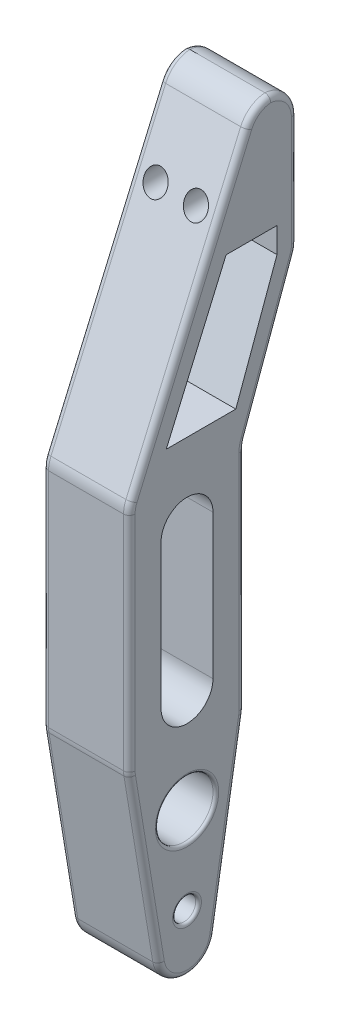
from build123d import *

# Parameters (mm, degrees)
SKETCH2_R           = 4
SKETCH2_R_2         = 10
BOSS_EXTRUDE1_DEPTH = 30
FILLET1_R           = 10
SKETCH3_R           = 4
CUT_EXTRUDE1_DEPTH  = 37
FILLET2_R           = 2
FILLET3_R           = 1


with BuildPart() as part:
    # Sketch2 → Boss-Extrude1 (new body)
    with BuildSketch(Plane(origin=(0, 0, 0), x_dir=(0, 0, -1), z_dir=(1, 0, 0))):
        with BuildLine():
            Line((-20, 60), (-9.867496998, -1.622498999))
            ThreePointArc((-9.867496998, -1.622498999), (0, -10), (9.867496998, -1.622498999))
            Line((9.867496998, -1.622498999), (20, 60))
            Line((20, 60), (20, 140))
            Line((20, 140), (38.198511713, 190))
            Line((38.198511713, 190), (38.198511713, 240))
            Line((38.198511713, 240), (23.198511713, 240))
            Line((23.198511713, 240), (-20, 140))
            Line((-20, 140), (-20, 60))
        make_face()
        with Locations((0, 10)):
            Circle(SKETCH2_R, mode=Mode.SUBTRACT)
        with Locations((0, 40)):
            Circle(SKETCH2_R_2, mode=Mode.SUBTRACT)
        with BuildLine():
            Line((9, 125), (9, 75))
            ThreePointArc((9, 75), (0, 66), (-9, 75))
            Line((-9, 75), (-9, 125))
            ThreePointArc((-9, 125), (0, 134), (9, 125))
        make_face(mode=Mode.SUBTRACT)
        Polygon((16.918398404, 152), (31.198511713, 191.234288865), (31.198511713, 200), (13.544324791, 200), (-7.190960832, 152), align=None, mode=Mode.SUBTRACT)
    extrude(amount=BOSS_EXTRUDE1_DEPTH)

    # Fillet1
    # the kernel refuses this fillet: 10 mm, written as the material it adds along each edge
    with BuildSketch(Plane(origin=(0, 140, -20), x_dir=(0, -1, 0), z_dir=(1, 0, 0))) as fillet1_piece_1:
        with BuildLine():
            CenterArc((FILLET1_R * 0.176326980708, FILLET1_R), FILLET1_R, 250, 20)
            Line((-FILLET1_R * 0.165693162617, FILLET1_R * 0.0603073792141), (0, 0))
            Line((0, 0), (FILLET1_R * 0.176326980708, 0))
        make_face()
    extrude(amount=30)
    # the kernel refuses this fillet: 10 mm, written as the material it takes off along each edge
    with BuildSketch(Plane(origin=(-4.408174518, 190, -38.198511713), x_dir=(0, -0.9396926207859084, 0.34202014332566866), z_dir=(1, 0, 0))) as fillet1_2_piece_1:
        with BuildLine():
            CenterArc((FILLET1_R * 0.176326980708, -FILLET1_R), FILLET1_R, 90, 20)
            Line((-FILLET1_R * 0.165693162617, -FILLET1_R * 0.0603073792141), (0, 0))
            Line((0, 0), (FILLET1_R * 0.176326980708, 0))
        make_face()
    extrude(amount=38.816349035, mode=Mode.SUBTRACT)
    with BuildSketch(Plane(origin=(-2.041649987, 60, -20), x_dir=(0, -0.9867496997597593, 0.16224989991992267), z_dir=(1, 0, 0))) as fillet1_2_piece_2:
        with BuildLine():
            CenterArc((FILLET1_R * 0.0816659994661, -FILLET1_R), FILLET1_R, 90, 9.337512654)
            Line((-FILLET1_R * 0.0805839004538, -FILLET1_R * 0.0132503002402), (0, 0))
            Line((0, 0), (FILLET1_R * 0.0816659994661, 0))
        make_face()
    extrude(amount=34.083299973, mode=Mode.SUBTRACT)
    with BuildSketch(Plane(origin=(-2.041649987, 60, 20), x_dir=(0, -0.98674969975976, -0.16224989991991845), z_dir=(1, 0, 0))) as fillet1_2_piece_3:
        with BuildLine():
            CenterArc((FILLET1_R * 0.0816659994661, FILLET1_R), FILLET1_R, 260.662487346, 9.337512654)
            Line((-FILLET1_R * 0.0805839004538, FILLET1_R * 0.0132503002402), (0, 0))
            Line((0, 0), (FILLET1_R * 0.0816659994661, 0))
        make_face()
    extrude(amount=34.083299973, mode=Mode.SUBTRACT)
    with BuildSketch(Plane(origin=(-16.433292653, 240, -23.198511713), x_dir=(0, -0.9180065694869886, 0.39656517544879144), z_dir=(1, 0, 0))) as fillet1_2_piece_4:
        with BuildLine():
            CenterArc((FILLET1_R * 0.657331706121, FILLET1_R), FILLET1_R, 203.363625857, 66.636374143)
            Line((-FILLET1_R * 0.260674863366, FILLET1_R * 0.603434824551), (0, 0))
            Line((0, 0), (FILLET1_R * 0.657331706121, 0))
        make_face()
    extrude(amount=62.866585306, mode=Mode.SUBTRACT)
    with BuildSketch(Plane(origin=(-25, 240, -38.198511713), x_dir=(0, -1, 0), z_dir=(1, 0, 0))) as fillet1_2_piece_5:
        with BuildLine():
            CenterArc((FILLET1_R, -FILLET1_R), FILLET1_R, 90, 90)
            Line((0, -FILLET1_R), (0, 0))
            Line((0, 0), (FILLET1_R, 0))
        make_face()
    extrude(amount=80, mode=Mode.SUBTRACT)
    with BuildSketch(Plane(origin=(-5.168975719, 140, 20), x_dir=(0, -1, 0), z_dir=(1, 0, 0))) as fillet1_2_piece_6:
        with BuildLine():
            CenterArc((FILLET1_R * 0.206759028753, FILLET1_R), FILLET1_R, 246.636374143, 23.363625857)
            Line((-FILLET1_R * 0.189806146696, FILLET1_R * 0.081993430513), (0, 0))
            Line((0, 0), (FILLET1_R * 0.206759028753, 0))
        make_face()
    extrude(amount=40.337951438, mode=Mode.SUBTRACT)

    # Sketch3 → Cut-Extrude1 (cut)
    with BuildSketch(Plane(origin=(0, 0, -38.198511713), x_dir=(-1, 0, 0), z_dir=(0, 0, -1))):
        with Locations(Location((-8, 212, 0), (0, 0, 90))):
            Circle(SKETCH3_R)
        with Locations(Location((-22, 212, 0), (0, 0, 90))):
            Circle(SKETCH3_R)
    extrude(amount=-CUT_EXTRUDE1_DEPTH, mode=Mode.SUBTRACT)

    # Fillet2
    # the kernel refuses this fillet: 2 mm, written as the material it takes off along each edge
    with BuildSketch(Plane(origin=(30, 0, 0), x_dir=(0, -0.16224989991992037, 0.9867496997597597), z_dir=(0, 0.9867496997597597, 0.16224989991992037))) as fillet2_piece_1:
        with BuildLine():
            CenterArc((10 - FILLET2_R, -FILLET2_R), FILLET2_R, 0, 90)
            Line((10, -FILLET2_R), (10, 0))
            Line((10, 0), (10 - FILLET2_R, 0))
        make_face()
    revolve(axis=Axis((30, 0, 0), (1, 0, 0)), revolution_arc=161.324974693, mode=Mode.SUBTRACT)
    with BuildSketch(Plane(origin=(30, -1.622498999, -9.867496998), x_dir=(0, 0.16224989991992012, 0.9867496997597598), z_dir=(0, 0.9867496997597597, -0.1622498999199201)), Plane(origin=(30, 59.194160995, 19.867496998), x_dir=(0, 0.1622498999199198, -0.9867496997597598), z_dir=(0, -0.9867496997597598, -0.16224989991991978))) as fillet2_piece_2:
        with BuildLine():
            CenterArc((FILLET2_R, -FILLET2_R), FILLET2_R, 90, 90)
            Line((0, -FILLET2_R), (0, 0))
            Line((0, 0), (FILLET2_R, 0))
        make_face()
    extrude(amount=61.633319989, mode=Mode.SUBTRACT)
    with BuildSketch(Plane(origin=(0, 233.965651754, -20.59176308), x_dir=(0, -0.3965651754487914, -0.9180065694869888), z_dir=(0, -0.9180065694869887, 0.3965651754487914))) as fillet2_piece_3:
        with BuildLine():
            CenterArc((FILLET2_R, FILLET2_R), FILLET2_R, 180, 90)
            Line((0, FILLET2_R), (0, 0))
            Line((0, 0), (FILLET2_R, 0))
        make_face()
    extrude(amount=100.290774977, mode=Mode.SUBTRACT)
    with BuildSketch(Plane(origin=(30, 233.965651754, -20.59176308), x_dir=(0, -0.3965651754487914, -0.9180065694869888), z_dir=(0, -0.9180065694869887, 0.3965651754487914))) as fillet2_piece_4:
        with BuildLine():
            CenterArc((FILLET2_R, -FILLET2_R), FILLET2_R, 90, 90)
            Line((0, -FILLET2_R), (0, 0))
            Line((0, 0), (FILLET2_R, 0))
        make_face()
    extrude(amount=100.290774977, mode=Mode.SUBTRACT)
    with BuildSketch(Plane(origin=(0, 191.763269807, -38.198511713), x_dir=(0, 0, 1), z_dir=(0, 1, 0))) as fillet2_piece_5:
        with BuildLine():
            CenterArc((FILLET2_R, FILLET2_R), FILLET2_R, 180, 90)
            Line((0, FILLET2_R), (0, 0))
            Line((0, 0), (FILLET2_R, 0))
        make_face()
    extrude(amount=38.236730193, mode=Mode.SUBTRACT)
    with BuildSketch(Plane(origin=(0, 141.656931626, -20.603073792), x_dir=(1, 0, 0), z_dir=(0, 0.9396926207859095, -0.34202014332566566))) as fillet2_piece_6:
        with BuildLine():
            CenterArc((FILLET2_R, -FILLET2_R), FILLET2_R, 90, 90)
            Line((0, -FILLET2_R), (0, 0))
            Line((0, 0), (FILLET2_R, 0))
        make_face()
    extrude(amount=49.68234901, mode=Mode.SUBTRACT)
    with BuildSketch(Plane(origin=(0, 60.816659995, -20), x_dir=(1, 0, 0), z_dir=(0, 1, 0))) as fillet2_piece_7:
        with BuildLine():
            CenterArc((FILLET2_R, -FILLET2_R), FILLET2_R, 90, 90)
            Line((0, -FILLET2_R), (0, 0))
            Line((0, 0), (FILLET2_R, 0))
        make_face()
    extrude(amount=77.420070198, mode=Mode.SUBTRACT)
    with BuildSketch(Plane(origin=(0, 59.194160995, 19.867496998), x_dir=(0, 0.1622498999199198, -0.9867496997597598), z_dir=(0, -0.9867496997597598, -0.16224989991991978)), Plane(origin=(0, -1.622498999, -9.867496998), x_dir=(0, 0.16224989991992012, 0.9867496997597598), z_dir=(0, 0.9867496997597597, -0.1622498999199201))) as fillet2_piece_8:
        with BuildLine():
            CenterArc((FILLET2_R, FILLET2_R), FILLET2_R, 180, 90)
            Line((0, FILLET2_R), (0, 0))
            Line((0, 0), (FILLET2_R, 0))
        make_face()
    extrude(amount=61.633319989, mode=Mode.SUBTRACT)
    with BuildSketch(Plane(origin=(0, 137.932409712, 20), x_dir=(0, 0, -1), z_dir=(0, -1, 0))) as fillet2_piece_9:
        with BuildLine():
            CenterArc((FILLET2_R, FILLET2_R), FILLET2_R, 180, 90)
            Line((0, FILLET2_R), (0, 0))
            Line((0, 0), (FILLET2_R, 0))
        make_face()
    extrude(amount=77.115749718, mode=Mode.SUBTRACT)
    with BuildSketch(Plane(origin=(0, 60.816659995, 10), x_dir=(0, -0.1622498999199592, 0.9867496997597532), z_dir=(0, -0.9867496997597532, -0.1622498999199592))) as fillet2_piece_10:
        with BuildLine():
            CenterArc((10 - FILLET2_R, -FILLET2_R), FILLET2_R, 0, 90)
            Line((10, -FILLET2_R), (10, 0))
            Line((10, 0), (10 - FILLET2_R, 0))
        make_face()
    revolve(axis=Axis((0, 60.816659995, 10), (-1, 0, 0)), revolution_arc=9.337512654, mode=Mode.SUBTRACT)
    with BuildSketch(Plane(origin=(0, 60.816659995, -10), x_dir=(0, 0, -1), z_dir=(0, 1, 0))) as fillet2_piece_11:
        with BuildLine():
            CenterArc((10 - FILLET2_R, -FILLET2_R), FILLET2_R, 0, 90)
            Line((10, -FILLET2_R), (10, 0))
            Line((10, 0), (10 - FILLET2_R, 0))
        make_face()
    revolve(axis=Axis((0, 60.816659995, -10), (-1, 0, 0)), revolution_arc=9.337512654, mode=Mode.SUBTRACT)
    with BuildSketch(Plane(origin=(0, 191.763269807, -28.198511713), x_dir=(0, 0, -1), z_dir=(0, 1, 0))) as fillet2_piece_12:
        with BuildLine():
            CenterArc((10 - FILLET2_R, -FILLET2_R), FILLET2_R, 0, 90)
            Line((10, -FILLET2_R), (10, 0))
            Line((10, 0), (10 - FILLET2_R, 0))
        make_face()
    revolve(axis=Axis((0, 191.763269807, -28.198511713), (-1, 0, 0)), revolution_arc=20, mode=Mode.SUBTRACT)
    with BuildSketch(Plane(origin=(0, 137.932409712, 10), x_dir=(0, 0, 1), z_dir=(0, -1, 0))) as fillet2_piece_13:
        with BuildLine():
            CenterArc((10 - FILLET2_R, -FILLET2_R), FILLET2_R, 0, 90)
            Line((10, -FILLET2_R), (10, 0))
            Line((10, 0), (10 - FILLET2_R, 0))
        make_face()
    revolve(axis=Axis((0, 137.932409712, 10), (-1, 0, 0)), revolution_arc=23.363625857, mode=Mode.SUBTRACT)
    with BuildSketch(Plane(origin=(0, 230, -28.198511713), x_dir=(0, 0.9125032729031795, 0.4090694035747302), z_dir=(0, -0.4090694035747302, 0.9125032729031795))) as fillet2_piece_14:
        with BuildLine():
            CenterArc((10 - FILLET2_R, -FILLET2_R), FILLET2_R, 0, 90)
            Line((10, -FILLET2_R), (10, 0))
            Line((10, 0), (10 - FILLET2_R, 0))
        make_face()
    revolve(axis=Axis((0, 230, -28.198511713), (-1, 0, 0)), revolution_arc=114.146389586, mode=Mode.SUBTRACT)
    with BuildSketch(Plane(origin=(0, 230, -29.771828775), x_dir=(0, 0.3965651754489641, 0.9180065694869141), z_dir=(0, -0.9180065694869141, 0.3965651754489641))) as fillet2_piece_15:
        with BuildLine():
            CenterArc((10 - FILLET2_R, -FILLET2_R), FILLET2_R, 0, 90)
            Line((10, -FILLET2_R), (10, 0))
            Line((10, 0), (10 - FILLET2_R, 0))
        make_face()
    revolve(axis=Axis((0, 230, -29.771828775), (-1, 0, 0)), revolution_arc=90.777863366, mode=Mode.SUBTRACT)
    with BuildSketch(Plane(origin=(30, 191.763269807, -38.198511713), x_dir=(0, 0, 1), z_dir=(0, 1, 0))) as fillet2_piece_16:
        with BuildLine():
            CenterArc((FILLET2_R, -FILLET2_R), FILLET2_R, 90, 90)
            Line((0, -FILLET2_R), (0, 0))
            Line((0, 0), (FILLET2_R, 0))
        make_face()
    extrude(amount=38.236730193, mode=Mode.SUBTRACT)
    with BuildSketch(Plane(origin=(30, 137.932409712, 20), x_dir=(0, 0, -1), z_dir=(0, -1, 0))) as fillet2_piece_17:
        with BuildLine():
            CenterArc((FILLET2_R, -FILLET2_R), FILLET2_R, 90, 90)
            Line((0, -FILLET2_R), (0, 0))
            Line((0, 0), (FILLET2_R, 0))
        make_face()
    extrude(amount=77.115749718, mode=Mode.SUBTRACT)
    with BuildSketch(Plane(origin=(30, 60.816659995, -20), x_dir=(-1, 0, 0), z_dir=(0, 1, 0))) as fillet2_piece_18:
        with BuildLine():
            CenterArc((FILLET2_R, FILLET2_R), FILLET2_R, 180, 90)
            Line((0, FILLET2_R), (0, 0))
            Line((0, 0), (FILLET2_R, 0))
        make_face()
    extrude(amount=77.420070198, mode=Mode.SUBTRACT)
    with BuildSketch(Plane(origin=(30, 141.656931626, -20.603073792), x_dir=(-1, 0, 0), z_dir=(0, 0.9396926207859095, -0.34202014332566566))) as fillet2_piece_19:
        with BuildLine():
            CenterArc((FILLET2_R, FILLET2_R), FILLET2_R, 180, 90)
            Line((0, FILLET2_R), (0, 0))
            Line((0, 0), (FILLET2_R, 0))
        make_face()
    extrude(amount=49.68234901, mode=Mode.SUBTRACT)
    with BuildSketch(Plane(origin=(30, 60.816659995, 10), x_dir=(0, -0.1622498999199592, 0.9867496997597532), z_dir=(0, -0.9867496997597532, -0.1622498999199592))) as fillet2_piece_20:
        with BuildLine():
            CenterArc((10 - FILLET2_R, FILLET2_R), FILLET2_R, 270, 90)
            Line((10, FILLET2_R), (10, 0))
            Line((10, 0), (10 - FILLET2_R, 0))
        make_face()
    revolve(axis=Axis((30, 60.816659995, 10), (-1, 0, 0)), revolution_arc=9.337512654, mode=Mode.SUBTRACT)
    with BuildSketch(Plane(origin=(30, 60.816659995, -10), x_dir=(0, 0, -1), z_dir=(0, 1, 0))) as fillet2_piece_21:
        with BuildLine():
            CenterArc((10 - FILLET2_R, FILLET2_R), FILLET2_R, 270, 90)
            Line((10, FILLET2_R), (10, 0))
            Line((10, 0), (10 - FILLET2_R, 0))
        make_face()
    revolve(axis=Axis((30, 60.816659995, -10), (-1, 0, 0)), revolution_arc=9.337512654, mode=Mode.SUBTRACT)
    with BuildSketch(Plane(origin=(30, 191.763269807, -28.198511713), x_dir=(0, 0, -1), z_dir=(0, 1, 0))) as fillet2_piece_22:
        with BuildLine():
            CenterArc((10 - FILLET2_R, FILLET2_R), FILLET2_R, 270, 90)
            Line((10, FILLET2_R), (10, 0))
            Line((10, 0), (10 - FILLET2_R, 0))
        make_face()
    revolve(axis=Axis((30, 191.763269807, -28.198511713), (-1, 0, 0)), revolution_arc=20, mode=Mode.SUBTRACT)
    with BuildSketch(Plane(origin=(30, 137.932409712, 10), x_dir=(0, 0, 1), z_dir=(0, -1, 0))) as fillet2_piece_23:
        with BuildLine():
            CenterArc((10 - FILLET2_R, FILLET2_R), FILLET2_R, 270, 90)
            Line((10, FILLET2_R), (10, 0))
            Line((10, 0), (10 - FILLET2_R, 0))
        make_face()
    revolve(axis=Axis((30, 137.932409712, 10), (-1, 0, 0)), revolution_arc=23.363625857, mode=Mode.SUBTRACT)
    with BuildSketch(Plane(origin=(30, 230, -28.198511713), x_dir=(0, 0.9125032729031795, 0.4090694035747302), z_dir=(0, -0.4090694035747302, 0.9125032729031795))) as fillet2_piece_24:
        with BuildLine():
            CenterArc((10 - FILLET2_R, FILLET2_R), FILLET2_R, 270, 90)
            Line((10, FILLET2_R), (10, 0))
            Line((10, 0), (10 - FILLET2_R, 0))
        make_face()
    revolve(axis=Axis((30, 230, -28.198511713), (-1, 0, 0)), revolution_arc=114.146389586, mode=Mode.SUBTRACT)
    with BuildSketch(Plane(origin=(30, 230, -29.771828775), x_dir=(0, 0.3965651754489641, 0.9180065694869141), z_dir=(0, -0.9180065694869141, 0.3965651754489641))) as fillet2_piece_25:
        with BuildLine():
            CenterArc((10 - FILLET2_R, FILLET2_R), FILLET2_R, 270, 90)
            Line((10, FILLET2_R), (10, 0))
            Line((10, 0), (10 - FILLET2_R, 0))
        make_face()
    revolve(axis=Axis((30, 230, -29.771828775), (-1, 0, 0)), revolution_arc=90.777863366, mode=Mode.SUBTRACT)
    with BuildSketch(Plane(origin=(0, 138.236730193, -30), x_dir=(0, 0.3420201433256692, 0.9396926207859082), z_dir=(0, 0.9396926207859082, -0.3420201433256692))) as fillet2_piece_26:
        with BuildLine():
            CenterArc((10 + FILLET2_R, FILLET2_R), FILLET2_R, 180, 90)
            Line((10 + FILLET2_R, 0), (10, 0))
            Line((10, 0), (10, FILLET2_R))
        make_face()
    revolve(axis=Axis((0, 138.236730193, -30), (1, 0, 0)), revolution_arc=20, mode=Mode.SUBTRACT)
    with BuildSketch(Plane(origin=(30, 138.236730193, -30), x_dir=(0, 0.3420201433256692, 0.9396926207859082), z_dir=(0, 0.9396926207859082, -0.3420201433256692))) as fillet2_piece_27:
        with BuildLine():
            CenterArc((10 + FILLET2_R, -FILLET2_R), FILLET2_R, 90, 90)
            Line((10 + FILLET2_R, 0), (10, 0))
            Line((10, 0), (10, -FILLET2_R))
        make_face()
    revolve(axis=Axis((30, 138.236730193, -30), (1, 0, 0)), revolution_arc=20, mode=Mode.SUBTRACT)
    with BuildSketch(Plane(origin=(0, 0, 0), x_dir=(0, -0.16224989991992037, 0.9867496997597597), z_dir=(0, 0.9867496997597597, 0.16224989991992037))) as fillet2_piece_28:
        with BuildLine():
            CenterArc((10 - FILLET2_R, FILLET2_R), FILLET2_R, 270, 90)
            Line((10, FILLET2_R), (10, 0))
            Line((10, 0), (10 - FILLET2_R, 0))
        make_face()
    revolve(axis=Axis((0, 0, 0), (1, 0, 0)), revolution_arc=161.324974693, mode=Mode.SUBTRACT)

    # Fillet3
    fillet3_edges = [part.edges().sort_by_distance(p)[0] for p in [
        (0, 40, 10),
        (30, 40, 10),
        (0, 10, 4),
        (30, 10, 4),
    ]]
    fillet(fillet3_edges, radius=FILLET3_R)


solid = part.part
